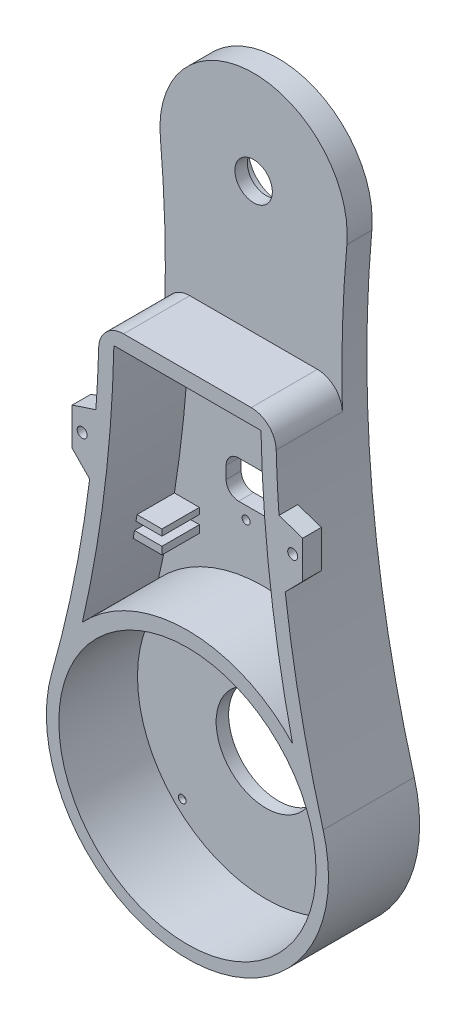
from build123d import *

# Parameters (mm, degrees)
SKETCH1_R               = 20
SKETCH1_R_2             = 7.5
BOSS_EXTRUDE1_DEPTH     = 36.5
SKETCH4_R               = 51.5
CUT_EXTRUDE3_DEPTH      = 31.5
CUT_EXTRUDE4_DEPTH      = 247.841548367
CUT_EXTRUDE4_DEPTH_BACK = 247.841548367
SKETCH5_W               = 26.5
SKETCH5_H               = 90
SHELL1_START            = 6
SHELL1_DEPTH            = 30.5
BOSS_EXTRUDE2_START     = -7.5
SKETCH7_R               = 2
BOSS_EXTRUDE2_DEPTH     = 7.5
BOSS_EXTRUDE3_DEPTH     = 15
CUT_EXTRUDE5_DEPTH      = 247.025913269
CUT_EXTRUDE5_DEPTH_BACK = 6
SKETCH9_R               = 1.6
SKETCH9_W               = 30
SKETCH9_H               = 15
FILLET1_R               = 10
FILLET2_R               = 5
SKETCH10_R              = 1.55
CUT_EXTRUDE6_DEPTH      = 10
SKETCH11_OUTSIDE_W      = 178.416
SKETCH11_OUTSIDE_H      = 359.416
SKETCH11_OUTSIDE_R      = 3.55
CUT_EXTRUDE8_DEPTH      = 3
SKETCH12_R              = 12.1
CUT_EXTRUDE9_DEPTH      = 5
SKETCH13_R              = 2.25
CUT_EXTRUDE10_DEPTH     = 6


# Read off the part's stored shape, not the designer's step: Shell1
with BuildPart() as part:
    # Sketch1 → Boss-Extrude1 (new body)
    with BuildSketch(Plane.XY):
        with BuildLine():
            ThreePointArc((-54.352625843, 15.42861186), (0, -56.5), (54.352625843, 15.42861186))
            ThreePointArc((54.352625843, 15.42861186), (37.535595393, 105.258460348), (37.34995219, 196.64872093))
            ThreePointArc((37.34995219, 196.64872093), (0, 237.5), (-37.34995219, 196.64872093))
            ThreePointArc((-37.34995219, 196.64872093), (-37.535595393, 105.258460348), (-54.352625843, 15.42861186))
        make_face()
        Circle(SKETCH1_R, mode=Mode.SUBTRACT)
        with Locations((0, 200)):
            Circle(SKETCH1_R_2, mode=Mode.SUBTRACT)
    extrude(amount=BOSS_EXTRUDE1_DEPTH)

    # Sketch4 → Cut-Extrude3 (cut)
    with BuildSketch(Plane.XY.offset(36.5)):
        Circle(SKETCH4_R)
    extrude(amount=-CUT_EXTRUDE3_DEPTH, mode=Mode.SUBTRACT)

    # Sketch5 → Cut-Extrude4 (cut, two sides: drawn at the far end of the back side and taken through both)
    with BuildSketch(Plane(origin=(0, 0, 0), x_dir=(0, 0, -1), z_dir=(1, 0, 0)).offset(-CUT_EXTRUDE4_DEPTH_BACK)):
        with Locations((-23.25, 192.5)):
            Rectangle(SKETCH5_W, SKETCH5_H)
    extrude(amount=CUT_EXTRUDE4_DEPTH + CUT_EXTRUDE4_DEPTH_BACK, mode=Mode.SUBTRACT)

    # Shell1 outline → Shell1 (cut)
    with BuildSketch(Plane.XY.offset(SHELL1_START)):
        with BuildLine():
            ThreePointArc((-42.077009937, 39.188968279), (0, 57.5), (42.077009937, 39.188968279))
            ThreePointArc((42.077009937, 39.188968279), (33.155030313, 90.022278833), (29.457543912, 141.5))
            Line((29.457543912, 141.5), (-29.457543912, 141.5))
            ThreePointArc((-29.457543912, 141.5), (-33.155030313, 90.022278833), (-42.077009937, 39.188968279))
        make_face()
    extrude(amount=SHELL1_DEPTH, mode=Mode.SUBTRACT)

    # Sketch7 → Boss-Extrude2 (add)
    # profile 1 of 2: a face of its own
    with BuildSketch(Plane.XY.offset(36.5).offset(BOSS_EXTRUDE2_START)):
        with BuildLine():
            Line((-39.159181835, 90.358571571), (-46.159181835, 97.5))
            Line((-46.159181835, 97.5), (-46.159181835, 112.5))
            Line((-46.159181835, 112.5), (-36.669554937, 115.653883533))
            ThreePointArc((-36.669554937, 115.653883533), (-37.753606302, 102.990404952), (-39.159181835, 90.358571571))
        make_face()
        with Locations((-42.159181835, 105)):
            Circle(SKETCH7_R, mode=Mode.SUBTRACT)
    # profile 2 of 2: a face of its own
    with BuildSketch(Plane.XY.offset(36.5).offset(BOSS_EXTRUDE2_START)):
        with BuildLine():
            Line((46.159181835, 97.5), (46.159181835, 112.5))
            Line((46.159181835, 112.5), (36.669554937, 115.653883533))
            ThreePointArc((36.669554937, 115.653883533), (37.753606302, 102.990404952), (39.159181835, 90.358571571))
            Line((39.159181835, 90.358571571), (46.159181835, 97.5))
        make_face()
        with Locations(Location((42.159181835, 105, 0), (0, 0, 180))):
            Circle(SKETCH7_R, mode=Mode.SUBTRACT)
    extrude(amount=BOSS_EXTRUDE2_DEPTH)

    # Sketch8 → Boss-Extrude3 (add)
    with BuildSketch(Plane.XY.offset(6)):
        with BuildLine():
            Line((-35.707844492, 72), (-25.707844492, 72))
            Line((-25.707844492, 72), (-25.707844492, 69.5))
            Line((-25.707844492, 69.5), (-36.114376268, 69.5))
            ThreePointArc((-36.114376268, 69.5), (-35.909546125, 70.749745632), (-35.707844492, 72))
        make_face()
        with BuildLine():
            Line((-36.705134195, 66), (-25.707844492, 66))
            Line((-25.707844492, 66), (-25.707844492, 63))
            Line((-25.707844492, 63), (-37.231629056, 63))
            ThreePointArc((-37.231629056, 63), (-36.966124321, 64.499603847), (-36.705134195, 66))
        make_face()
        with BuildLine():
            Line((25.707844492, 63), (37.231629056, 63))
            ThreePointArc((37.231629056, 63), (36.966124321, 64.499603847), (36.705134195, 66))
            Line((36.705134195, 66), (25.707844492, 66))
            Line((25.707844492, 66), (25.707844492, 63))
        make_face()
        with BuildLine():
            Line((25.707844492, 69.5), (36.114376268, 69.5))
            ThreePointArc((36.114376268, 69.5), (35.909546125, 70.749745632), (35.707844492, 72))
            Line((35.707844492, 72), (25.707844492, 72))
            Line((25.707844492, 72), (25.707844492, 69.5))
        make_face()
    extrude(amount=BOSS_EXTRUDE3_DEPTH)

    # Sketch9 → Cut-Extrude5 (cut, two sides: drawn at the far end of the back side and taken through both)
    with BuildSketch(Plane.XY.offset(6).offset(-CUT_EXTRUDE5_DEPTH_BACK)):
        with Locations((-7, 77)):
            Circle(SKETCH9_R)
        with Locations((7, 77)):
            Circle(SKETCH9_R)
        with Locations((0, 89.5)):
            Rectangle(SKETCH9_W, SKETCH9_H)
    extrude(amount=CUT_EXTRUDE5_DEPTH + CUT_EXTRUDE5_DEPTH_BACK, mode=Mode.SUBTRACT)

    # Fillet1
    fillet1_edges = [part.edges().sort_by_distance(p)[0] for p in [
        (35.369251346, 147.5, 23.25),
        (-35.369251346, 147.5, 23.25),
    ]]
    fillet(fillet1_edges, radius=FILLET1_R)

    # Fillet2
    fillet2_edges = [part.edges().sort_by_distance(p)[0] for p in [
        (15, 97, 3),
        (15, 82, 3),
        (-15, 82, 3),
        (-15, 97, 3),
    ]]
    fillet(fillet2_edges, radius=FILLET2_R)

    # Sketch10 → Cut-Extrude6 (cut)
    with BuildSketch(Plane.XY.offset(5)):
        with Locations((-33.587572106, 33.587572106)):
            Circle(SKETCH10_R)
        with Locations((33.587572106, 33.587572106)):
            Circle(SKETCH10_R)
        with Locations((33.587572106, -33.587572106)):
            Circle(SKETCH10_R)
        with Locations((-33.587572106, -33.587572106)):
            Circle(SKETCH10_R)
    extrude(amount=-CUT_EXTRUDE6_DEPTH, mode=Mode.SUBTRACT)

    # Sketch11 outside → Cut-Extrude8 (cut)
    # profile 1 of 5: a face of its own
    with BuildSketch(Plane(origin=(0, 0, 0), x_dir=(-1, 0, 0), z_dir=(0, 0, -1))):
        with Locations((0, 90.5)):
            Rectangle(SKETCH11_OUTSIDE_W, SKETCH11_OUTSIDE_H)
        with BuildLine():
            ThreePointArc((37.34995219, 196.64872093), (37.535595393, 105.258460348), (54.352625843, 15.42861186))
            ThreePointArc((54.352625843, 15.42861186), (0, -56.5), (-54.352625843, 15.42861186))
            ThreePointArc((-54.352625843, 15.42861186), (-37.535595393, 105.258460348), (-37.34995219, 196.64872093))
            ThreePointArc((-37.34995219, 196.64872093), (0, 237.5), (37.34995219, 196.64872093))
        make_face(mode=Mode.SUBTRACT)
    # profile 2 of 5: a face of its own
    with BuildSketch(Plane(origin=(0, 0, 0), x_dir=(-1, 0, 0), z_dir=(0, 0, -1))):
        with Locations((-33.587572106, -33.587572106)):
            Circle(SKETCH11_OUTSIDE_R)
    # profile 3 of 5: a face of its own
    with BuildSketch(Plane(origin=(0, 0, 0), x_dir=(-1, 0, 0), z_dir=(0, 0, -1))):
        with Locations((33.587572106, -33.587572106)):
            Circle(SKETCH11_OUTSIDE_R)
    # profile 4 of 5: a face of its own
    with BuildSketch(Plane(origin=(0, 0, 0), x_dir=(-1, 0, 0), z_dir=(0, 0, -1))):
        with Locations((33.587572106, 33.587572106)):
            Circle(SKETCH11_OUTSIDE_R)
    # profile 5 of 5: a face of its own
    with BuildSketch(Plane(origin=(0, 0, 0), x_dir=(-1, 0, 0), z_dir=(0, 0, -1))):
        with Locations((-33.587572106, 33.587572106)):
            Circle(SKETCH11_OUTSIDE_R)
    extrude(amount=-CUT_EXTRUDE8_DEPTH, mode=Mode.SUBTRACT)

    # Sketch12 → Cut-Extrude9 (cut)
    with BuildSketch(Plane(origin=(0, 0, 0), x_dir=(-1, 0, 0), z_dir=(0, 0, -1))):
        with Locations((0, 200)):
            Circle(SKETCH12_R)
    extrude(amount=-CUT_EXTRUDE9_DEPTH, mode=Mode.SUBTRACT)

    # Sketch13 → Cut-Extrude10 (cut)
    with BuildSketch(Plane(origin=(0, 0, 0), x_dir=(-1, 0, 0), z_dir=(0, 0, -1))):
        with Locations((0, 222.5)):
            Circle(SKETCH13_R)
        with Locations((22.5, 200)):
            Circle(SKETCH13_R)
        with Locations((0, 177.5)):
            Circle(SKETCH13_R)
        with Locations((-22.5, 200)):
            Circle(SKETCH13_R)
    extrude(amount=-CUT_EXTRUDE10_DEPTH, mode=Mode.SUBTRACT)


solid = part.part
